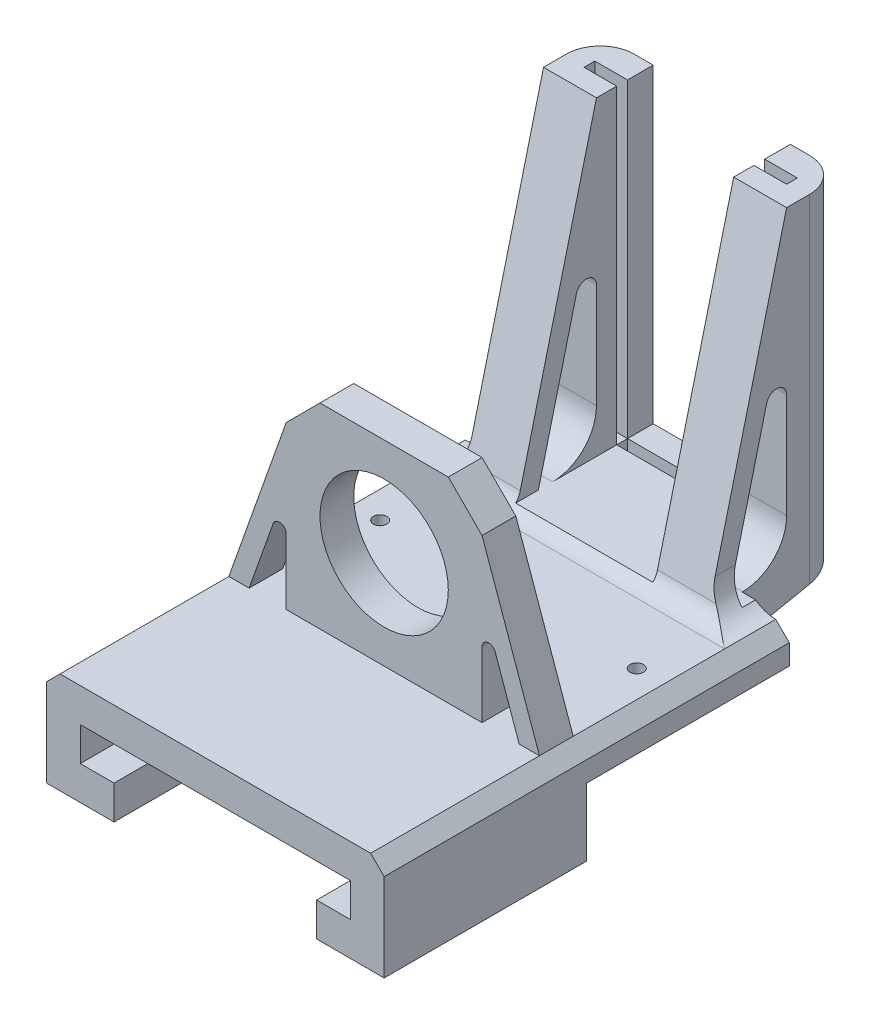
from build123d import *

# Parameters (mm, degrees)
SKETCH_2_W           = 60
SKETCH_2_H           = 60
EXTRUDE_1_DEPTH      = 3
EXTRUDE_START        = 30
EXTRUDE_3_DEPTH      = 30
EXTRUDE_START_2      = 3
SKETCH_8_W           = 36
SKETCH_8_H           = 20
EXTRUDE_4_DEPTH      = 3
CUT_EXTRUDE_START    = 6
SKETCH_10_W          = 20.32
SKETCH_10_H          = 1.6
CUT_EXTRUDE_2_DEPTH  = 3
EXTRUDE_START_3      = 6
EXTRUDE_5_DEPTH      = 46
EXTRUDE_START_4      = -18
EXTRUDE_6_DEPTH      = 36
EXTRUDE_START_5      = 18
EXTRUDE_8_DEPTH      = 7.84
EXTRUDE_START_6      = -10.16
EXTRUDE_9_DEPTH      = 7.84
EXTRUDE_10_DEPTH     = 36
SKETCH_16_W          = 5
SKETCH_16_H          = 60
CUT_EXTRUDE_3_DEPTH  = 3
EXTRUDE_11_DEPTH     = 4
EXTRUDE_12_DEPTH     = 4
FILLET_3_R           = 5
FILLET_4_R           = 10
SKETCH_22_W          = 50
SKETCH_22_H          = 2
EXTRUDE_14_DEPTH     = 60
CUT_EXTRUDE_START_2  = 30
CUT_EXTRUDE_4_DEPTH  = 60
SKETCH_26_R          = 12.5
CUT_EXTRUDE_6_DEPTH  = 2
FILLET_5_R           = 3
FILLET_7_R           = 5
FILLET_8_R           = 6.5
FILLET_9_R           = 1.5
FILLET_10_R          = 3
EXTRUDE_START_7      = 5
SKETCH_27_W          = 29
SKETCH_27_H          = 5
EXTRUDE_15_DEPTH     = 29
CUT_EXTRUDE_START_3  = 5
SKETCH_28_R          = 9.5
CUT_EXTRUDE_7_DEPTH  = 5
CUT_EXTRUDE_8_DEPTH  = 5
EXTRUDE_16_DEPTH     = 5
FILLET_11_R          = 1
SKETCH_31_R          = 1
CUT_EXTRUDE_9_DEPTH  = 5
SKETCH_32_R          = 1.75
CUT_EXTRUDE_10_DEPTH = 2


with BuildPart() as part:
    # 草图2 → 凸台-拉伸1 (new body)
    with BuildSketch(Plane(origin=(0, 0, 0), x_dir=(1, 0, 0), z_dir=(0, 1, 0))):
        Rectangle(SKETCH_2_W, SKETCH_2_H)
    extrude(amount=EXTRUDE_1_DEPTH)

    # 草图7 → 凸台-拉伸3 (add)
    with BuildSketch(Plane.XY.offset(EXTRUDE_START)):
        Polygon((-25, 0), (-25, -10), (-15, -10), (-15, -5), (-20, -5), (-20, 0), align=None)
        Polygon((20, 0), (25, 0), (25, -10), (15, -10), (15, -5), (20, -5), align=None)
    extrude(amount=-EXTRUDE_3_DEPTH)

    # 草图8 → 凸台-拉伸4 (add)
    with BuildSketch(Plane(origin=(0, 0, 0), x_dir=(1, 0, 0), z_dir=(0, 1, 0)).offset(EXTRUDE_START_2)):
        with Locations((0, 35)):
            Rectangle(SKETCH_8_W, SKETCH_8_H)
    extrude(amount=EXTRUDE_4_DEPTH)

    # 草图10 → 切除-拉伸2 (cut)
    with BuildSketch(Plane(origin=(0, 0, 0), x_dir=(1, 0, 0), z_dir=(0, 1, 0)).offset(CUT_EXTRUDE_START)):
        with Locations((0, 40.4)):
            Rectangle(SKETCH_10_W, SKETCH_10_H)
    extrude(amount=-CUT_EXTRUDE_2_DEPTH, mode=Mode.SUBTRACT)

    # 草图11 → 凸台-拉伸5 (add)
    with BuildSketch(Plane(origin=(0, 0, 0), x_dir=(1, 0, 0), z_dir=(0, 1, 0)).offset(EXTRUDE_START_3)):
        Polygon((10.16, 41.2), (10.16, 45), (18, 45), (18, 36.6), (10.16, 36.6), (10.16, 39.6), (15, 39.6), (15, 41.2), align=None)
        Polygon((-15, 41.2), (-15, 39.6), (-10.16, 39.6), (-10.16, 36.6), (-18, 36.6), (-18, 45), (-10.16, 45), (-10.16, 41.2), align=None)
    extrude(amount=EXTRUDE_5_DEPTH)

    # 草图12 → 凸台-拉伸6 (add)
    with BuildSketch(Plane(origin=(0, 0, 0), x_dir=(0, 0, -1), z_dir=(1, 0, 0)).offset(EXTRUDE_START_4)):
        Polygon((30, 0), (35, 3), (30, 3), align=None)
    extrude(amount=EXTRUDE_6_DEPTH)

    # 草图13 → 凸台-拉伸8 (add)
    with BuildSketch(Plane(origin=(0, 0, 0), x_dir=(0, 0, -1), z_dir=(1, 0, 0)).offset(EXTRUDE_START_5)):
        Polygon((25, 6), (36.6, 52), (36.6, 40.103448276), (28, 6), align=None)
    extrude(amount=-EXTRUDE_8_DEPTH)

    # 草图14 → 凸台-拉伸9 (add)
    with BuildSketch(Plane(origin=(0, 0, 0), x_dir=(0, 0, -1), z_dir=(1, 0, 0)).offset(EXTRUDE_START_6)):
        Polygon((36.6, 52), (25, 6), (28, 6), (36.6, 40.103448276), align=None)
    extrude(amount=-EXTRUDE_9_DEPTH)

    # 草图15 → 凸台-拉伸10 (add)
    with BuildSketch(Plane(origin=(0, 0, 0), x_dir=(0, 0, -1), z_dir=(1, 0, 0)).offset(EXTRUDE_START_4)):
        Polygon((25, 3), (24.243478261, 3), (25, 6), align=None)
    extrude(amount=EXTRUDE_10_DEPTH)

    # 草图16 → 切除-拉伸3 (cut)
    with BuildSketch(Plane(origin=(0, 0, 0), x_dir=(1, 0, 0), z_dir=(0, 1, 0))):
        with Locations((27.5, 0)):
            Rectangle(SKETCH_16_W, SKETCH_16_H)
        with Locations((-27.5, 0)):
            Rectangle(SKETCH_16_W, SKETCH_16_H)
    extrude(amount=CUT_EXTRUDE_3_DEPTH, mode=Mode.SUBTRACT)

    # 草图17 → 凸台-拉伸11 (add)
    with BuildSketch(Plane(origin=(0, 0, 0), x_dir=(0, 0, -1), z_dir=(1, 0, 0)).offset(EXTRUDE_START_5)):
        Polygon((30, 0), (45, 3), (30, 3), align=None)
    extrude(amount=-EXTRUDE_11_DEPTH)

    # 草图18 → 凸台-拉伸12 (add)
    with BuildSketch(Plane(origin=(0, 0, 0), x_dir=(0, 0, -1), z_dir=(1, 0, 0)).offset(EXTRUDE_START_4)):
        Polygon((30, 0), (30, 3), (45, 3), align=None)
    extrude(amount=EXTRUDE_12_DEPTH)

    # 圆角3
    # the kernel refuses this fillet: 5 mm, written as the material it takes off along each edge
    with BuildSketch(Plane(origin=(18, -9.5, -45), x_dir=(0, 0, 1), z_dir=(0, 1, 0)), Plane(origin=(-18, 64.5, -45), x_dir=(0, 0, 1), z_dir=(0, -1, 0))) as fillet_3_piece_1:
        with BuildLine():
            CenterArc((FILLET_3_R, -FILLET_3_R), FILLET_3_R, 90, 90)
            Line((0, -FILLET_3_R), (0, 0))
            Line((0, 0), (FILLET_3_R, 0))
        make_face()
    extrude(amount=74, mode=Mode.SUBTRACT)

    # 圆角4
    fillet_4_edges = [part.edges().sort_by_distance(p)[0] for p in [
        (0, 3, -35),
    ]]
    fillet(fillet_4_edges, radius=FILLET_4_R)

    # 草图22 → 凸台-拉伸14 (add)
    with BuildSketch(Plane.XY.offset(EXTRUDE_START)):
        with Locations((0, 4)):
            Rectangle(SKETCH_22_W, SKETCH_22_H)
    extrude(amount=-EXTRUDE_14_DEPTH)

    # 草图24 → 切除-拉伸4 (cut)
    with BuildSketch(Plane.XY.offset(CUT_EXTRUDE_START_2)):
        Polygon((-25, 5), (-23, 5), (-25, 3), align=None)
        Polygon((25, 5), (25, 3), (23, 5), align=None)
    extrude(amount=-CUT_EXTRUDE_4_DEPTH, mode=Mode.SUBTRACT)

    # 草图26 → 切除-拉伸6 (cut)
    with BuildSketch(Plane(origin=(0, 0, 0), x_dir=(1, 0, 0), z_dir=(0, 1, 0))):
        with Locations(Location((0, 0, 0), (0, 0, 270))):
            Circle(SKETCH_26_R)
    extrude(amount=CUT_EXTRUDE_6_DEPTH, mode=Mode.SUBTRACT)

    # 圆角5
    # the kernel refuses this fillet: 3 mm, written as the material it takes off along each edge
    with BuildSketch(Plane(origin=(0, 0, 0), x_dir=(0, 0, 1), z_dir=(-1, 0, 0))) as fillet_5_piece_1:
        with BuildLine():
            CenterArc((15.328427125, 3), FILLET_5_R, 199.471220634, 70.528779366)
            Line((12.5, 2), (12.443431458, 1.98))
            ThreePointArc((12.443431458, 1.98), (12.44, 1), (12.44, 0))
            Line((12.44, 0), (12.5, -0.06))
            Line((12.5, -0.06), (15.328427125, -0.06))
            Line((15.328427125, -0.06), (15.328427125, 0))
        make_face()
    revolve(axis=Axis((0, 0, 0), (0, 1, 0)), mode=Mode.SUBTRACT)

    # 圆角7
    # the kernel refuses this fillet: 5 mm, written as the material it adds along each edge
    with BuildSketch(Plane(origin=(-18, 5, -12.247826087), x_dir=(0, 1, 0), z_dir=(0, 0, -1))) as fillet_7_piece_1_section:
        with BuildLine():
            CenterArc((FILLET_7_R, -FILLET_7_R), FILLET_7_R, 90, 90)
            Line((0, -FILLET_7_R), (0, 0))
            Line((0, 0), (FILLET_7_R, 0))
        make_face()
    fillet_7_piece_1 = extrude(amount=30.252173913, mode=Mode.PRIVATE)
    fillet_7_piece_1 = split(fillet_7_piece_1, bisect_by=Plane(origin=(-18.571810287, 7.311264389, -25.330666672), z_dir=(0, -0.24451904524274018, -0.9696444897556934)), keep=Keep.TOP, mode=Mode.PRIVATE)
    fillet_7_piece_1 = split(fillet_7_piece_1, bisect_by=Plane(origin=(-18.571810287, 6.599974755, -28.151297982), z_dir=(0, 0.24451904524274015, 0.9696444897556934)), keep=Keep.TOP, mode=Mode.PRIVATE)
    add(fillet_7_piece_1)
    with BuildSketch(Plane(origin=(-18, 5, -12.247826087), x_dir=(0, 1, 0), z_dir=(0, 0, -1))) as fillet_7_piece_2_section:
        with BuildLine():
            CenterArc((FILLET_7_R, -FILLET_7_R), FILLET_7_R, 90, 90)
            Line((0, -FILLET_7_R), (0, 0))
            Line((0, 0), (FILLET_7_R, 0))
        make_face()
    fillet_7_piece_2 = extrude(amount=17.752173913, mode=Mode.PRIVATE)
    fillet_7_piece_2 = split(fillet_7_piece_2, bisect_by=Plane(origin=(-19.572975188, 6, -28.927333211), z_dir=(0, -1, 0)), keep=Keep.TOP, mode=Mode.PRIVATE)
    fillet_7_piece_2 = split(fillet_7_piece_2, bisect_by=Plane(origin=(-19.572975188, 5.678002788, -27.918800703), z_dir=(0, -0.24451904524274015, -0.9696444897556934)), keep=Keep.TOP, mode=Mode.PRIVATE)
    add(fillet_7_piece_2)
    with BuildSketch(Plane(origin=(18, 5, -30), x_dir=(1, 0, 0), z_dir=(0, 0, 1))) as fillet_7_piece_3_section:
        with BuildLine():
            CenterArc((FILLET_7_R, FILLET_7_R), FILLET_7_R, 180, 90)
            Line((0, FILLET_7_R), (0, 0))
            Line((0, 0), (FILLET_7_R, 0))
        make_face()
    fillet_7_piece_3 = extrude(amount=17.752173913, mode=Mode.PRIVATE)
    fillet_7_piece_3 = split(fillet_7_piece_3, bisect_by=Plane(origin=(19.572975189, 6, -28.92733321), z_dir=(0, -1, 0)), keep=Keep.TOP, mode=Mode.PRIVATE)
    fillet_7_piece_3 = split(fillet_7_piece_3, bisect_by=Plane(origin=(19.572975189, 6.389292423, -25.098169394), z_dir=(0, -0.24451904524274018, -0.9696444897556934)), keep=Keep.TOP, mode=Mode.PRIVATE)
    add(fillet_7_piece_3)
    with BuildSketch(Plane(origin=(18, 5, -42.5), x_dir=(1, 0, 0), z_dir=(0, 0, 1))) as fillet_7_piece_4_section:
        with BuildLine():
            CenterArc((FILLET_7_R, FILLET_7_R), FILLET_7_R, 180, 90)
            Line((0, FILLET_7_R), (0, 0))
            Line((0, 0), (FILLET_7_R, 0))
        make_face()
    fillet_7_piece_4 = extrude(amount=30.252173913, mode=Mode.PRIVATE)
    fillet_7_piece_4 = split(fillet_7_piece_4, bisect_by=Plane(origin=(18.571810287, 7.311264389, -25.330666672), z_dir=(0, -0.24451904524274018, -0.9696444897556934)), keep=Keep.TOP, mode=Mode.PRIVATE)
    fillet_7_piece_4 = split(fillet_7_piece_4, bisect_by=Plane(origin=(18.571810287, 6.599974754, -28.151297982), z_dir=(0, 0.24451904524274015, 0.9696444897556934)), keep=Keep.TOP, mode=Mode.PRIVATE)
    add(fillet_7_piece_4)

    # 圆角8
    fillet_8_edges = [part.edges().sort_by_distance(p)[0] for p in [
        (14.08, 6, -36.6),
        (-14.08, 6, -36.6),
    ]]
    fillet(fillet_8_edges, radius=FILLET_8_R)

    # 圆角9
    fillet_9_edges = [part.edges().sort_by_distance(p)[0] for p in [
        (14.08, 40.103448276, -36.6),
        (-14.08, 40.103448276, -36.6),
    ]]
    fillet(fillet_9_edges, radius=FILLET_9_R)

    # 圆角10
    # the kernel refuses this fillet: 3 mm, written as the material it adds along each edge
    with BuildSketch(Plane(origin=(-28.843489259, 5, -24.747826087), x_dir=(-2.8138525512499648e-15, 0.9696444897556498, -0.24451904524291254), z_dir=(1, 0, 0))) as fillet_10_piece_1_section:
        with BuildLine():
            CenterArc((FILLET_10_R * 0.779131901165, FILLET_10_R), FILLET_10_R, 194.153412588, 75.846587412)
            Line((-FILLET_10_R * 0.190512588591, FILLET_10_R * 0.755480954757), (0, 0))
            Line((0, 0), (FILLET_10_R * 0.779131901165, 0))
        make_face()
    fillet_10_piece_1 = extrude(amount=57.686978517, mode=Mode.PRIVATE)
    fillet_10_piece_1 = split(fillet_10_piece_1, bisect_by=Plane(origin=(-15.866529779, 6, -24.192724601), z_dir=(0, -1, 0)), keep=Keep.TOP, mode=Mode.PRIVATE)
    fillet_10_piece_1 = fillet_10_piece_1 - Plane(origin=(-23, 10, -24.192724601), x_dir=(0, 1, 0), z_dir=(0, 0, 1)) * Cylinder(5, 125, mode=Mode.PRIVATE)
    fillet_10_piece_1 = split(fillet_10_piece_1, bisect_by=Plane(origin=(-10.16, 5.299241574, -24.192724601), z_dir=(-1, 0, 0)), keep=Keep.TOP, mode=Mode.PRIVATE)
    fillet_10_piece_1 = split(fillet_10_piece_1, bisect_by=Plane(origin=(-19.283644102, 8.716355898, -24.192724601), z_dir=(0.7071067811865488, -0.7071067811865462, 0)), keep=Keep.TOP, mode=Mode.PRIVATE)
    add(fillet_10_piece_1)
    with BuildSketch(Plane(origin=(-28.843489259, 5, -24.747826087), x_dir=(-2.8138525512499648e-15, 0.9696444897556498, -0.24451904524291254), z_dir=(1, 0, 0))) as fillet_10_piece_2_section:
        with BuildLine():
            CenterArc((FILLET_10_R * 0.779131901165, FILLET_10_R), FILLET_10_R, 194.153412588, 75.846587412)
            Line((-FILLET_10_R * 0.190512588591, FILLET_10_R * 0.755480954757), (0, 0))
            Line((0, 0), (FILLET_10_R * 0.779131901165, 0))
        make_face()
    fillet_10_piece_2 = extrude(amount=57.686978517, mode=Mode.PRIVATE)
    fillet_10_piece_2 = split(fillet_10_piece_2, bisect_by=Plane(origin=(-14.854595225, 6, -25.046116775), z_dir=(0, 1, 0)), keep=Keep.TOP, mode=Mode.PRIVATE)
    fillet_10_piece_2 = fillet_10_piece_2 - Plane(origin=(-23, 10, -25.046116775), x_dir=(0, 1, 0), z_dir=(0, 0, 1)) * Cylinder(5, 125, mode=Mode.PRIVATE)
    fillet_10_piece_2 = split(fillet_10_piece_2, bisect_by=Plane(origin=(-10.16, 6.410540932, -25.046116775), z_dir=(-1, 0, 0)), keep=Keep.TOP, mode=Mode.PRIVATE)
    fillet_10_piece_2 = split(fillet_10_piece_2, bisect_by=Plane(origin=(-18.222027147, 9.777972853, -25.046116775), z_dir=(0.7071067811865488, -0.7071067811865462, 0)), keep=Keep.TOP, mode=Mode.PRIVATE)
    add(fillet_10_piece_2)
    with BuildSketch(Plane(origin=(-28.843489259, 5, -24.747826087), x_dir=(-2.8138525512499648e-15, 0.9696444897556498, -0.24451904524291254), z_dir=(1, 0, 0))) as fillet_10_piece_3_section:
        with BuildLine():
            CenterArc((FILLET_10_R * 0.779131901165, FILLET_10_R), FILLET_10_R, 194.153412588, 75.846587412)
            Line((-FILLET_10_R * 0.190512588591, FILLET_10_R * 0.755480954757), (0, 0))
            Line((0, 0), (FILLET_10_R * 0.779131901165, 0))
        make_face()
    fillet_10_piece_3 = extrude(amount=57.686978517, mode=Mode.PRIVATE)
    fillet_10_piece_3 = split(fillet_10_piece_3, bisect_by=Plane(origin=(0, 6, -24.222418931), z_dir=(0, -1, 0)), keep=Keep.TOP, mode=Mode.PRIVATE)
    fillet_10_piece_3 = split(fillet_10_piece_3, bisect_by=Plane(origin=(-10.16, 5.321349944, -24.222418931), z_dir=(1, 0, 0)), keep=Keep.TOP, mode=Mode.PRIVATE)
    fillet_10_piece_3 = split(fillet_10_piece_3, bisect_by=Plane(origin=(10.16, 5.321349944, -24.222418931), z_dir=(-1, 0, 0)), keep=Keep.TOP, mode=Mode.PRIVATE)
    add(fillet_10_piece_3)
    with BuildSketch(Plane(origin=(-28.843489259, 5, -24.747826087), x_dir=(-2.8138525512499648e-15, 0.9696444897556498, -0.24451904524291254), z_dir=(1, 0, 0))) as fillet_10_piece_4_section:
        with BuildLine():
            CenterArc((FILLET_10_R * 0.779131901165, FILLET_10_R), FILLET_10_R, 194.153412588, 75.846587412)
            Line((-FILLET_10_R * 0.190512588591, FILLET_10_R * 0.755480954757), (0, 0))
            Line((0, 0), (FILLET_10_R * 0.779131901165, 0))
        make_face()
    fillet_10_piece_4 = extrude(amount=57.686978517, mode=Mode.PRIVATE)
    fillet_10_piece_4 = split(fillet_10_piece_4, bisect_by=Plane(origin=(15.866529778, 6, -24.192724601), z_dir=(0, -1, 0)), keep=Keep.TOP, mode=Mode.PRIVATE)
    fillet_10_piece_4 = fillet_10_piece_4 - Plane(origin=(23, 10, -24.192724601), x_dir=(1, 0, 0), z_dir=(0, 0, -1)) * Cylinder(5, 125, mode=Mode.PRIVATE)
    fillet_10_piece_4 = split(fillet_10_piece_4, bisect_by=Plane(origin=(10.16, 5.299241574, -24.192724601), z_dir=(1, 0, 0)), keep=Keep.TOP, mode=Mode.PRIVATE)
    fillet_10_piece_4 = split(fillet_10_piece_4, bisect_by=Plane(origin=(19.283644102, 8.716355898, -24.192724601), z_dir=(-0.7071067811865306, -0.7071067811865644, 0)), keep=Keep.TOP, mode=Mode.PRIVATE)
    add(fillet_10_piece_4)
    with BuildSketch(Plane(origin=(-28.843489259, 5, -24.747826087), x_dir=(-2.8138525512499648e-15, 0.9696444897556498, -0.24451904524291254), z_dir=(1, 0, 0))) as fillet_10_piece_5_section:
        with BuildLine():
            CenterArc((FILLET_10_R * 0.779131901165, FILLET_10_R), FILLET_10_R, 194.153412588, 75.846587412)
            Line((-FILLET_10_R * 0.190512588591, FILLET_10_R * 0.755480954757), (0, 0))
            Line((0, 0), (FILLET_10_R * 0.779131901165, 0))
        make_face()
    fillet_10_piece_5 = extrude(amount=57.686978517, mode=Mode.PRIVATE)
    fillet_10_piece_5 = split(fillet_10_piece_5, bisect_by=Plane(origin=(14.854595225, 6, -25.046116775), z_dir=(0, 1, 0)), keep=Keep.TOP, mode=Mode.PRIVATE)
    fillet_10_piece_5 = fillet_10_piece_5 - Plane(origin=(23, 10, -25.046116775), x_dir=(1, 0, 0), z_dir=(0, 0, -1)) * Cylinder(5, 125, mode=Mode.PRIVATE)
    fillet_10_piece_5 = split(fillet_10_piece_5, bisect_by=Plane(origin=(10.16, 6.410540932, -25.046116775), z_dir=(1, 0, 0)), keep=Keep.TOP, mode=Mode.PRIVATE)
    fillet_10_piece_5 = split(fillet_10_piece_5, bisect_by=Plane(origin=(18.222027147, 9.777972853, -25.046116775), z_dir=(-0.7071067811865306, -0.7071067811865644, 0)), keep=Keep.TOP, mode=Mode.PRIVATE)
    add(fillet_10_piece_5)

    # 草图27 → 凸台-拉伸15 (add)
    with BuildSketch(Plane(origin=(0, 0, 0), x_dir=(1, 0, 0), z_dir=(0, 1, 0)).offset(EXTRUDE_START_7)):
        with Locations((0, -2.5)):
            Rectangle(SKETCH_27_W, SKETCH_27_H)
    extrude(amount=EXTRUDE_15_DEPTH)

    # 草图28 → 切除-拉伸7 (cut)
    with BuildSketch(Plane.XY.offset(CUT_EXTRUDE_START_3)):
        with Locations((0, 19.5)):
            Circle(SKETCH_28_R)
    extrude(amount=-CUT_EXTRUDE_7_DEPTH, mode=Mode.SUBTRACT)

    # 草图29 → 切除-拉伸8 (cut)
    with BuildSketch(Plane.XY.offset(CUT_EXTRUDE_START_3)):
        Polygon((-14.5, 34), (-9.5, 34), (-14.5, 29), align=None)
        Polygon((14.5, 34), (9.5, 34), (14.5, 29), align=None)
    extrude(amount=-CUT_EXTRUDE_8_DEPTH, mode=Mode.SUBTRACT)

    # 草图30 → 凸台-拉伸16 (add)
    with BuildSketch(Plane.XY):
        Polygon((-23, 5), (-14.5, 29), (-14.5, 20.529411765), (-20, 5), align=None)
        Polygon((20, 5), (23, 5), (14.5, 29), (14.5, 20.529411765), align=None)
    extrude(amount=EXTRUDE_16_DEPTH)

    # 圆角11
    fillet_11_edges = [part.edges().sort_by_distance(p)[0] for p in [
        (-14.5, 20.529411765, 2.5),
        (14.5, 20.529411765, 2.5),
    ]]
    fillet(fillet_11_edges, radius=FILLET_11_R)

    # 草图31 → 切除-拉伸9 (cut)
    with BuildSketch(Plane(origin=(0, 0, 0), x_dir=(1, 0, 0), z_dir=(0, 1, 0)).offset(CUT_EXTRUDE_START_3)):
        with Locations(Location((-19, 13.410430383, 0), (0, 0, 270))):
            Circle(SKETCH_31_R)
        with Locations(Location((19, 13.410430383, 0), (0, 0, 270))):
            Circle(SKETCH_31_R)
    extrude(amount=-CUT_EXTRUDE_9_DEPTH, mode=Mode.SUBTRACT)

    # 草图32 → 切除-拉伸10 (cut)
    with BuildSketch(Plane(origin=(0, 0, 0), x_dir=(1, 0, 0), z_dir=(0, 1, 0))):
        with Locations(Location((19, 13.410430383, 0), (0, 0, 270))):
            Circle(SKETCH_32_R)
        with Locations(Location((-19, 13.410430383, 0), (0, 0, 270))):
            Circle(SKETCH_32_R)
    extrude(amount=CUT_EXTRUDE_10_DEPTH, mode=Mode.SUBTRACT)


solid = part.part
